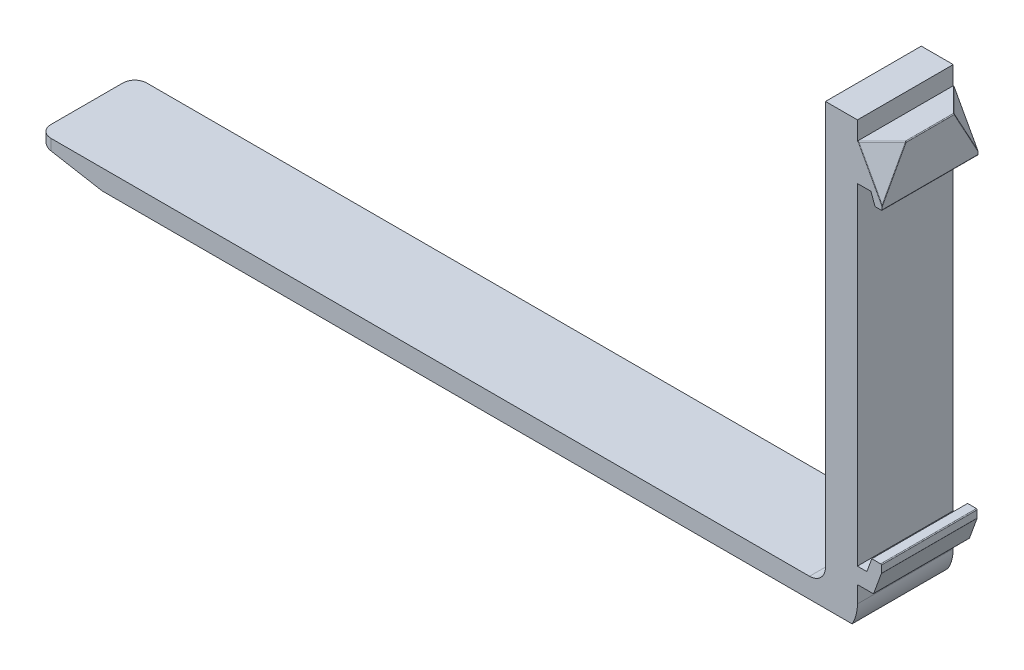
from build123d import *

# Parameters (mm, degrees)
BOSS_EXTRUDE1_DEPTH = 60
FILLET1_R           = 20
FILLET2_R           = 50
SKETCH2_W           = 946.025641026
SKETCH2_H           = 25
CUT_EXTRUDE1_DEPTH  = 1147.843494118
FILLET3_R           = 15
BOSS_EXTRUDE2_DEPTH = 60
CHAMFER1_START      = 58.356662002
CHAMFER1_OUTLINE_W  = 43
CHAMFER1_OUTLINE_H  = 66
CHAMFER1_DEPTH      = 20.643337998
CHAMFER2_START      = 58.356662002
CHAMFER2_OUTLINE_W  = 43
CHAMFER2_OUTLINE_H  = 66
CHAMFER2_DEPTH      = 20.643337998
FILLET4_R           = 1


with BuildPart() as part:
    # Sketch1 → Boss-Extrude1 (new, symmetric)
    with BuildSketch(Plane.XY):
        Polygon((0, 0), (0, -525), (-985, -525), (-985, -536), (-765, -575), (40, -575), (40, 0), align=None)
    extrude(amount=BOSS_EXTRUDE1_DEPTH, both=True)

    # Fillet1
    fillet1_edges = [part.edges().sort_by_distance(p)[0] for p in [
        (0, -525, 0),
    ]]
    fillet(fillet1_edges, radius=FILLET1_R)

    # Fillet2
    fillet2_edges = [part.edges().sort_by_distance(p)[0] for p in [
        (40, -575, 0),
    ]]
    fillet(fillet2_edges, radius=FILLET2_R)

    # Sketch2 → Cut-Extrude1 (cut, through all)
    with BuildSketch(Plane.XY.offset(60)):
        with Locations((-433.012820513, -562.5)):
            Rectangle(SKETCH2_W, SKETCH2_H)
    extrude(amount=-CUT_EXTRUDE1_DEPTH, mode=Mode.SUBTRACT)

    # Fillet3
    fillet3_edges = [part.edges().sort_by_distance(p)[0] for p in [
        (-985, -530.5, 60),
        (-985, -530.5, -60),
    ]]
    fillet(fillet3_edges, radius=FILLET3_R)

    # Sketch4 → Boss-Extrude2 (add, symmetric)
    with BuildSketch(Plane.XY):
        Polygon((40, -23), (71, -23), (71, -83), (62, -83), (56.90441672, -69), (40, -69), align=None)
        Polygon((40, -484), (51.812506017, -484), (58, -467), (70, -467), (70, -477), (60.172803675, -504), (40, -504), align=None)
    extrude(amount=BOSS_EXTRUDE2_DEPTH, both=True)

    # Chamfer1: read off the stored shape, not the designer's step
    # Chamfer1 outline → Chamfer1 (cut)
    with BuildSketch(Plane(origin=(0, 0, 0), x_dir=(0.7514973063417119, -0.31591606508632464, -0.5791794526582624), z_dir=(0.659736158294474, 0.35985608634244, 0.659736158294474)).offset(CHAMFER1_START)):
        with Locations((23.5, -66)):
            Rectangle(CHAMFER1_OUTLINE_W, CHAMFER1_OUTLINE_H)
    extrude(amount=CHAMFER1_DEPTH, mode=Mode.SUBTRACT)

    # Chamfer2: read off the stored shape, not the designer's step
    # Chamfer2 outline → Chamfer2 (cut)
    with BuildSketch(Plane(origin=(0, 0, 0), x_dir=(0.7514973063417119, -0.31591606508632464, 0.5791794526582624), z_dir=(0.659736158294474, 0.35985608634244, -0.659736158294474)).offset(CHAMFER2_START)):
        with Locations((23.5, 66)):
            Rectangle(CHAMFER2_OUTLINE_W, CHAMFER2_OUTLINE_H)
    extrude(amount=CHAMFER2_DEPTH, mode=Mode.SUBTRACT)

    # Fillet4
    fillet4_edges = [part.edges().sort_by_distance(p)[0] for p in [
        (56, -50.5, 60),
        (71, -23, 0),
        (71, -50.5, 45),
        (56, -23, 45),
        (56, -23, -45),
        (71, -50.5, -45),
        (56, -50.5, -60),
        (71, -83, 0),
        (40, -504, 0),
        (60.172803675, -504, 0),
        (70, -477, 0),
        (70, -467, 0),
    ]]
    fillet(fillet4_edges, radius=FILLET4_R)


solid = part.part
